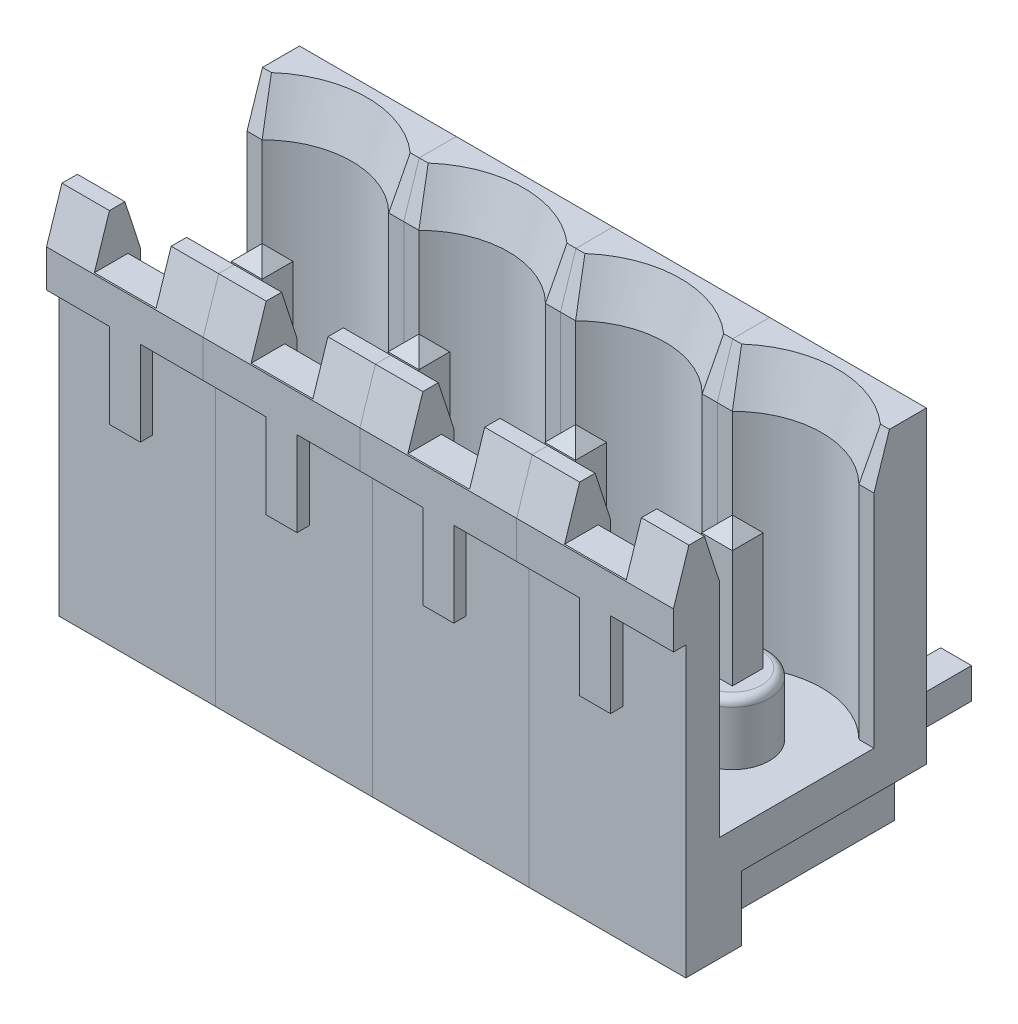
from build123d import *
from OCP.BRepFilletAPI import BRepFilletAPI_MakeChamfer

# Parameters (mm, degrees)
SKETCH_1_W             = 5.08
SKETCH_1_H             = 12.1
EXTRUDE_1_DEPTH        = 8.2
CUT_EXTRUDE_1_DEPTH    = 8.7
SKETCH_3_R             = 1.2
EXTRUDE_2_DEPTH        = 2
FILLET_1_R             = 0.25
CHAMFER_1_SIZE         = 0.5
CHAMFER_1_SIZE2        = 1.538841769
SKETCH_4_W             = 2
SKETCH_4_H             = 1.010953213
CUT_EXTRUDE_2_DEPTH    = 4.75
SKETCH_5_W             = 2
SKETCH_5_H             = 1.705458635
CUT_EXTRUDE_3_DEPTH    = 1.5
CHAMFER_2_SIZE         = 0.5
CHAMFER_2_SIZE2        = 1.538841769
SKETCH_6_W             = 5.08
SKETCH_6_H             = 6.6
CUT_EXTRUDE_4_DEPTH    = 0.4
SKETCH_7_W             = 2.04
SKETCH_7_H             = 2.75
CUT_EXTRUDE_5_DEPTH    = 0.4
EXTRUDE_1_2_DEPTH      = 0.5
EXTRUDE_1_2_DEPTH_BACK = 0.5
CHAMFER_3_SIZE         = 0.5
SKETCH_9_W             = 1
SKETCH_9_H             = 2.1
SKETCH_9_W_2           = 1.04
CUT_EXTRUDE_6_DEPTH    = 6
PATTERN_LINEAR_1_COUNT = 4
PATTERN_LINEAR_1_PITCH = 5.08
MOVE_BODY_1_ANGLE      = 180


with BuildPart() as part:
    # Эскиз1 → Extrude 1 (new body)
    with BuildSketch(Plane(origin=(0, 0, 0), x_dir=(1, 0, 0), z_dir=(0, 1, 0))):
        Rectangle(SKETCH_1_W, SKETCH_1_H)
    extrude(amount=EXTRUDE_1_DEPTH)

    # Эскиз2 → Вырез-Вытянуть1 (cut)
    with BuildSketch(Plane.XY.offset(6.05)):
        with BuildLine():
            Line((-2.54, 6.7), (2.54, 6.7))
            Line((2.54, 6.7), (2.54, 1.7))
            Line((2.54, 1.7), (2.05121915, 1.7))
            ThreePointArc((2.05121915, 1.7), (0, 0.85), (-2.05121915, 1.7))
            Line((-2.05121915, 1.7), (-2.54, 1.7))
            Line((-2.54, 1.7), (-2.54, 6.7))
        make_face()
    extrude(amount=-CUT_EXTRUDE_1_DEPTH, mode=Mode.SUBTRACT)

    # Эскиз3 → Бобышка-Вытянуть2 (add)
    with BuildSketch(Plane.XY.offset(-2.65)):
        with Locations((0, 3.75)):
            Circle(SKETCH_3_R)
    extrude(amount=EXTRUDE_2_DEPTH)

    # Скругление1
    fillet_1_edges = [part.edges().sort_by_distance(p)[0] for p in [
        (-1.2, 3.75, -0.65),
    ]]
    fillet(fillet_1_edges, radius=FILLET_1_R)

    # Фаска1: one chamfer whose edges measure the first distance from different faces: ONE call of the kernel's chamfer builder (chamfer() names one face for all edges)
    chamfer_1_edges_1 = [part.edges().sort_by_distance(p)[0] for p in [
        (0, 6.7, 6.05),
    ]]
    chamfer_1_side_1 = [part.faces().sort_by_distance(p)[0] for p in [
        (0, 7.45, 6.05),
    ]]
    chamfer_1_edges_2 = [part.edges().sort_by_distance(p)[0] for p in [
        (2.295609575, 1.7, 6.05),
        (-2.295609575, 1.7, 6.05),
        (0, 0.85, 6.05),
    ]]
    chamfer_1_side_2 = [part.faces().sort_by_distance(p)[0] for p in [
        (0, 0.655214235, 6.05),
    ]]
    chamfer_1 = BRepFilletAPI_MakeChamfer(part.part.solid().wrapped)
    for e in chamfer_1_edges_1:
        chamfer_1.Add(CHAMFER_1_SIZE, CHAMFER_1_SIZE2, e.wrapped, chamfer_1_side_1[0].wrapped)  # the first distance lies on this face
    for e in chamfer_1_edges_2:
        chamfer_1.Add(CHAMFER_1_SIZE, CHAMFER_1_SIZE2, e.wrapped, chamfer_1_side_2[0].wrapped)  # the first distance lies on this face
    add(Compound.cast(chamfer_1.Shape()), mode=Mode.REPLACE)

    # Эскиз4 → Вырез-Вытянуть2 (cut)
    with BuildSketch(Plane.XY.offset(6.05)):
        with Locations((0, 6.594523394)):
            Rectangle(SKETCH_4_W, SKETCH_4_H)
    extrude(amount=-CUT_EXTRUDE_2_DEPTH, mode=Mode.SUBTRACT)

    # Эскиз5 → Вырез-Вытянуть3 (cut)
    with BuildSketch(Plane.XY.offset(6.05)):
        with Locations((0, 7.552729318)):
            Rectangle(SKETCH_5_W, SKETCH_5_H)
    extrude(amount=-CUT_EXTRUDE_3_DEPTH, mode=Mode.SUBTRACT)

    # Фаска2
    chamfer_2_edges = [part.edges().sort_by_distance(p)[0] for p in [
        (-1.77, 8.2, 6.05),
    ]]
    chamfer_2_side = [part.faces().sort_by_distance(p)[0] for p in [
        (-1.77, 7.7, 6.05),
    ]]
    chamfer(chamfer_2_edges, length=CHAMFER_2_SIZE, length2=CHAMFER_2_SIZE2, reference=chamfer_2_side[0])

    # Эскиз6 → Вырез-Вытянуть4 (cut)
    with BuildSketch(Plane(origin=(0, 8.2, 0), x_dir=(1, 0, 0), z_dir=(0, 1, 0))):
        with Locations((0, 2.75)):
            Rectangle(SKETCH_6_W, SKETCH_6_H)
    extrude(amount=-CUT_EXTRUDE_4_DEPTH, mode=Mode.SUBTRACT)

    # Эскиз7 → Вырез-Вытянуть5 (cut)
    with BuildSketch(Plane(origin=(0, 8.2, 0), x_dir=(1, 0, 0), z_dir=(0, 1, 0))):
        with Locations((1.52, -1.925)):
            Rectangle(SKETCH_7_W, SKETCH_7_H)
        with Locations((-1.52, -1.925)):
            Rectangle(SKETCH_7_W, SKETCH_7_H)
    extrude(amount=-CUT_EXTRUDE_5_DEPTH, mode=Mode.SUBTRACT)

    # Эскиз9 → Вырез-Вытянуть6 (cut)
    with BuildSketch(Plane.XZ):
        with Locations((0, -5)):
            Rectangle(SKETCH_9_W, SKETCH_9_H)
        with Locations((-2.02, -5)):
            Rectangle(SKETCH_9_W_2, SKETCH_9_H)
        with Locations((2.02, -5)):
            Rectangle(SKETCH_9_W_2, SKETCH_9_H)
    extrude(amount=-CUT_EXTRUDE_6_DEPTH, mode=Mode.SUBTRACT)


with BuildPart() as body_2:
    # Эскиз8 → Extrude 1 2 (new, two sides: drawn at the far end of the back side and taken through both)
    with BuildSketch(Plane(origin=(0, 0, 0), x_dir=(0, 0, -1), z_dir=(1, 0, 0)).offset(-EXTRUDE_1_2_DEPTH_BACK)):
        with BuildLine():
            Line((-3.65, 3.25), (3.95, 3.25))
            Line((3.95, 3.25), (3.95, -4))
            Line((3.95, -4), (4.95, -4))
            Line((4.95, -4), (4.95, 3.25))
            ThreePointArc((4.95, 3.25), (4.657106781, 3.957106781), (3.95, 4.25))
            Line((3.95, 4.25), (-3.65, 4.25))
            Line((-3.65, 4.25), (-3.65, 3.25))
        make_face()
    extrude(amount=EXTRUDE_1_2_DEPTH + EXTRUDE_1_2_DEPTH_BACK)

    # Фаска3
    chamfer_3_edges = [body_2.edges().sort_by_distance(p)[0] for p in [
        (0, 3.25, 3.65),
        (0, 4.25, 3.65),
        (0, -4, -4.95),
        (0, -4, -3.95),
        (0.5, -4, -4.45),
        (0.5, 3.75, 3.65),
        (-0.5, 3.75, 3.65),
        (-0.5, -4, -4.45),
    ]]
    chamfer(chamfer_3_edges, length=CHAMFER_3_SIZE - 0.0001)  # a hair under: the kernel refuses the full size


with BuildPart() as pattern_linear_1_1:
    # Линейный массив1: pattern copy
    add(part.part.moved(Location(Vector(-1, 0, 0) * (1 * PATTERN_LINEAR_1_PITCH))))


with BuildPart() as pattern_linear_1_2:
    # Линейный массив1: pattern copy
    add(part.part.moved(Location(Vector(-1, 0, 0) * (2 * PATTERN_LINEAR_1_PITCH))))


with BuildPart() as pattern_linear_1_3:
    # Линейный массив1: pattern copy
    add(part.part.moved(Location(Vector(-1, 0, 0) * (3 * PATTERN_LINEAR_1_PITCH))))


with BuildPart() as pattern_linear_1_4:
    # Линейный массив1: pattern copy
    add(body_2.part.moved(Location(Vector(-1, 0, 0) * (1 * PATTERN_LINEAR_1_PITCH))))


with BuildPart() as pattern_linear_1_5:
    # Линейный массив1: pattern copy
    add(body_2.part.moved(Location(Vector(-1, 0, 0) * (2 * PATTERN_LINEAR_1_PITCH))))


with BuildPart() as pattern_linear_1_6:
    # Линейный массив1: pattern copy
    add(body_2.part.moved(Location(Vector(-1, 0, 0) * (3 * PATTERN_LINEAR_1_PITCH))))


with BuildPart() as body_2_1:
    # Move Body 1: moved
    add(body_2.part.rotate(Axis((0, 0, 0), (0, 0.7071067811865488, 0.7071067811865462)), MOVE_BODY_1_ANGLE))


with BuildPart() as part_1:
    # Move Body 1: moved
    add(part.part.rotate(Axis((0, 0, 0), (0, 0.7071067811865488, 0.7071067811865462)), MOVE_BODY_1_ANGLE))


with BuildPart() as pattern_linear_1_4_1:
    # Move Body 1: moved
    add(pattern_linear_1_4.part.rotate(Axis((0, 0, 0), (0, 0.7071067811865488, 0.7071067811865462)), MOVE_BODY_1_ANGLE))


with BuildPart() as pattern_linear_1_1_1:
    # Move Body 1: moved
    add(pattern_linear_1_1.part.rotate(Axis((0, 0, 0), (0, 0.7071067811865488, 0.7071067811865462)), MOVE_BODY_1_ANGLE))


with BuildPart() as pattern_linear_1_2_1:
    # Move Body 1: moved
    add(pattern_linear_1_2.part.rotate(Axis((0, 0, 0), (0, 0.7071067811865488, 0.7071067811865462)), MOVE_BODY_1_ANGLE))


with BuildPart() as pattern_linear_1_3_1:
    # Move Body 1: moved
    add(pattern_linear_1_3.part.rotate(Axis((0, 0, 0), (0, 0.7071067811865488, 0.7071067811865462)), MOVE_BODY_1_ANGLE))


with BuildPart() as pattern_linear_1_5_1:
    # Move Body 1: moved
    add(pattern_linear_1_5.part.rotate(Axis((0, 0, 0), (0, 0.7071067811865488, 0.7071067811865462)), MOVE_BODY_1_ANGLE))


with BuildPart() as pattern_linear_1_6_1:
    # Move Body 1: moved
    add(pattern_linear_1_6.part.rotate(Axis((0, 0, 0), (0, 0.7071067811865488, 0.7071067811865462)), MOVE_BODY_1_ANGLE))


with BuildPart() as pattern_linear_1_6_2:
    # Move Body 2: read off the stored shape, not the designer's step
    # Move Body 2: moved
    add(pattern_linear_1_6_1.part.moved(Location((0, 4.45, 0))))


with BuildPart() as pattern_linear_1_5_2:
    # Move Body 2 2: moved
    add(pattern_linear_1_5_1.part.moved(Location((0, 4.45, 0))))


with BuildPart() as pattern_linear_1_3_2:
    # Move Body 2 3: moved
    add(pattern_linear_1_3_1.part.moved(Location((0, 4.45, 0))))


with BuildPart() as pattern_linear_1_2_2:
    # Move Body 2 4: moved
    add(pattern_linear_1_2_1.part.moved(Location((0, 4.45, 0))))


with BuildPart() as pattern_linear_1_1_2:
    # Move Body 2 5: moved
    add(pattern_linear_1_1_1.part.moved(Location((0, 4.45, 0))))


with BuildPart() as pattern_linear_1_4_2:
    # Move Body 2 6: moved
    add(pattern_linear_1_4_1.part.moved(Location((0, 4.45, 0))))


with BuildPart() as part_2:
    # Move Body 2 7: moved
    add(part_1.part.moved(Location((0, 4.45, 0))))


with BuildPart() as body_2_2:
    # Move Body 2 8: moved
    add(body_2_1.part.moved(Location((0, 4.45, 0))))


solid = Compound([pattern_linear_1_6_2.part, pattern_linear_1_5_2.part, pattern_linear_1_3_2.part, pattern_linear_1_2_2.part, pattern_linear_1_1_2.part, pattern_linear_1_4_2.part, part_2.part, body_2_2.part])
